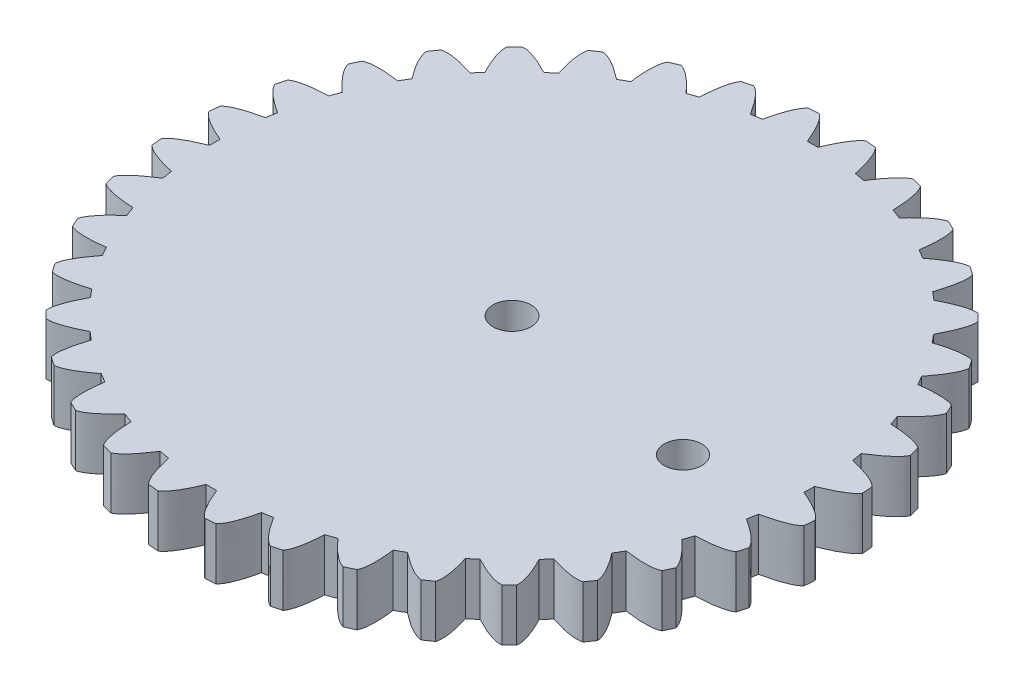
from build123d import *

# Parameters (mm, degrees)
BOSS_EXTRUDE4_DEPTH = 5
CIRPATTERN6_COUNT   = 36
SKETCH2_R           = 1.825
CUT_EXTRUDE2_DEPTH  = 10
SKETCH4_R           = 1.8
CUT_EXTRUDE3_DEPTH  = 10


with BuildPart() as part:
    # Sketch1 → Boss-Extrude4 (new body)
    with BuildSketch(Plane(origin=(0, 0, 0), x_dir=(1, 0, 0), z_dir=(0, 1, 0))):
        with BuildLine():
            ThreePointArc((22.805736751, 21.8420485), (22.457036123, 22.200410807), (22.102704987, 22.553206948))
            add(Edge.make_bspline(
                [(22.102704987, 22.553206948), (21.149593054, 22.664461932), (18.918639135, 21.512477328)],
                knots=[0.625101597, 0.625101597, 0.625101597, 1, 1, 1], degree=2))
            ThreePointArc((18.918639135, 21.512477328), (-20.37318884, -20.140376461), (21.728482418, 18.670153703))
            add(Edge.make_bspline(
                [(21.728482418, 18.670153703), (22.906030578, 20.887720895), (22.805736751, 21.8420485)],
                knots=[0, 0, 0, 0.374898403, 0.374898403, 0.374898403], degree=2))
        make_face()
    boss_extrude4 = extrude(amount=BOSS_EXTRUDE4_DEPTH)

    # CirPattern6: Boss-Extrude4 ×36 about axis
    cirpattern6_axis = Axis((0, 5, 0), (0, 1, 0))
    for i in range(1, CIRPATTERN6_COUNT):
        add(boss_extrude4.rotate(cirpattern6_axis, i * 360 / CIRPATTERN6_COUNT))

    # Sketch2 → Cut-Extrude2 (cut)
    with BuildSketch(Plane(origin=(0, 5, 0), x_dir=(1, 0, 0), z_dir=(0, 1, 0))):
        Circle(SKETCH2_R)
    extrude(amount=-CUT_EXTRUDE2_DEPTH, mode=Mode.SUBTRACT)

    # Sketch4 → Cut-Extrude3 (cut)
    with BuildSketch(Plane.XZ):
        with Locations((19.720308876, 3.333079333)):
            Circle(SKETCH4_R)
    extrude(amount=-CUT_EXTRUDE3_DEPTH, mode=Mode.SUBTRACT)


solid = part.part
